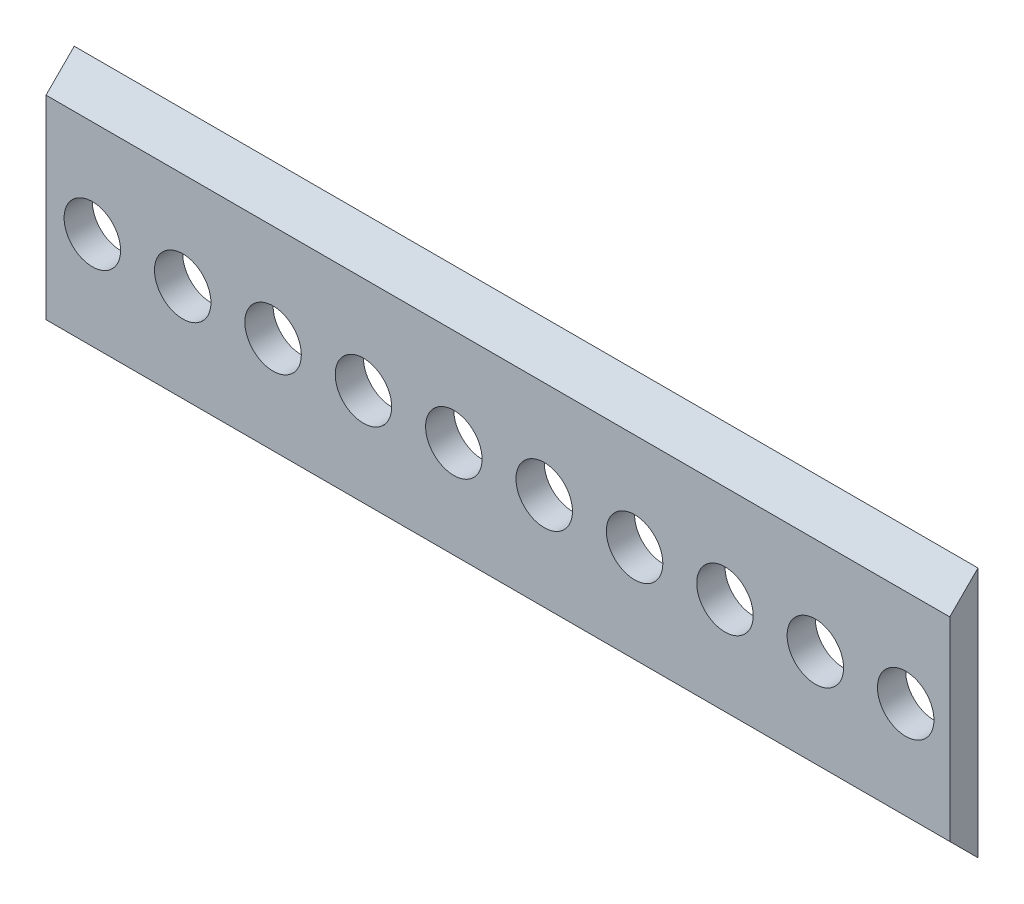
from build123d import *

# Parameters (mm, degrees)
SKETCH1_W           = 101.6
SKETCH1_H           = 28.215251418
SKETCH1_R           = 3.175
BOSS_EXTRUDE1_DEPTH = 3.175
CHAMFER1_SIZE       = 3.175


with BuildPart() as part:
    # Sketch1 → Boss-Extrude1 (new body)
    with BuildSketch(Plane.XY):
        with Locations((50.8, 14.107625709)):
            Rectangle(SKETCH1_W, SKETCH1_H)
        with Locations((5.2076336, 14.107625709)):
            Circle(SKETCH1_R, mode=Mode.SUBTRACT)
        with Locations((15.3676336, 14.107625709)):
            Circle(SKETCH1_R, mode=Mode.SUBTRACT)
        with Locations((25.5276336, 14.107625709)):
            Circle(SKETCH1_R, mode=Mode.SUBTRACT)
        with Locations((35.6876336, 14.107625709)):
            Circle(SKETCH1_R, mode=Mode.SUBTRACT)
        with Locations((45.8476336, 14.107625709)):
            Circle(SKETCH1_R, mode=Mode.SUBTRACT)
        with Locations((56.0076336, 14.107625709)):
            Circle(SKETCH1_R, mode=Mode.SUBTRACT)
        with Locations((66.1676336, 14.107625709)):
            Circle(SKETCH1_R, mode=Mode.SUBTRACT)
        with Locations((76.3276336, 14.107625709)):
            Circle(SKETCH1_R, mode=Mode.SUBTRACT)
        with Locations((86.4876336, 14.107625709)):
            Circle(SKETCH1_R, mode=Mode.SUBTRACT)
        with Locations((96.6476336, 14.107625709)):
            Circle(SKETCH1_R, mode=Mode.SUBTRACT)
    extrude(amount=BOSS_EXTRUDE1_DEPTH)

    # Chamfer1
    chamfer1_edges = [part.edges().sort_by_distance(p)[0] for p in [
        (50.8, 0, 3.175),
        (50.8, 28.215251418, 3.175),
    ]]
    chamfer(chamfer1_edges, length=CHAMFER1_SIZE - 0.0001)  # a hair under: the kernel refuses the full size


solid = part.part
